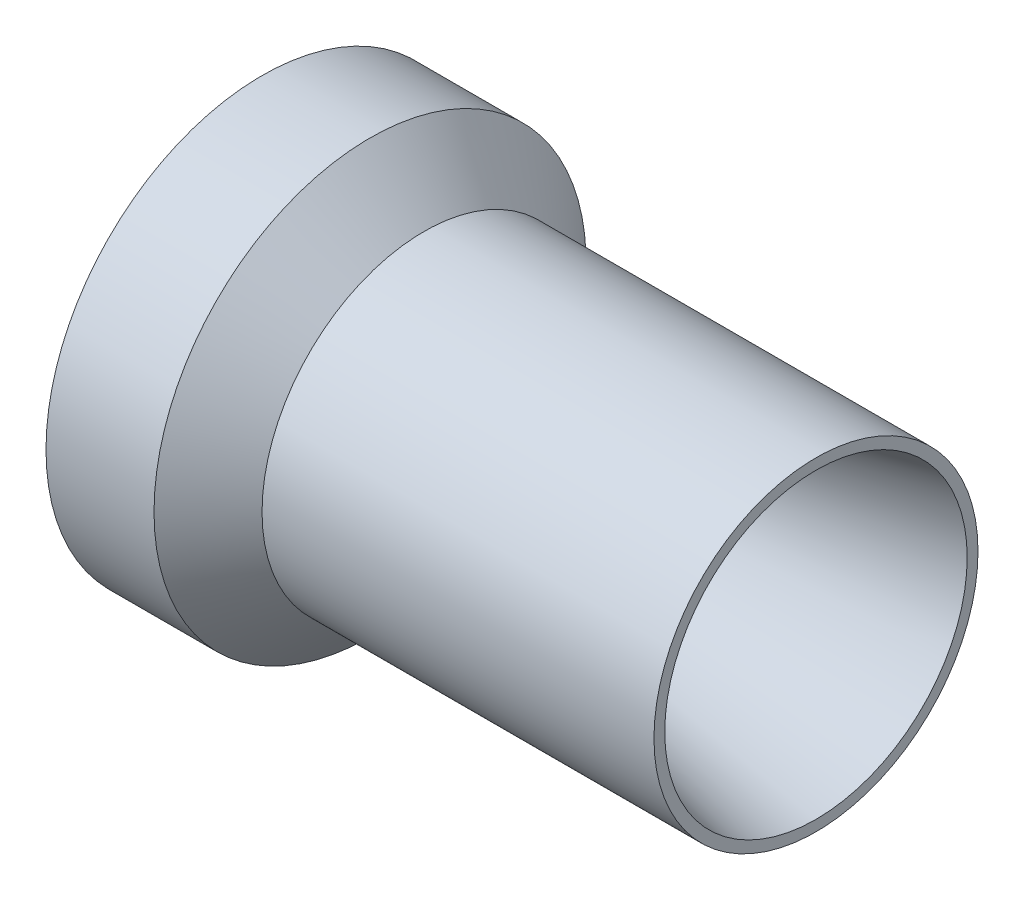
from build123d import *


with BuildPart() as part:
    # Sketch1 → Revolve1 (revolve)
    with BuildSketch(Plane.XY):
        Polygon((130.263203586, 22.225), (130.263203586, 24.765), (40.64, 43.815), (34.29, 43.815), (0, 9.525), (25.4, 9.525), (38.1, 22.225), align=None)
    revolve(axis=Axis((0, 60.325, 0), (1, 0, 0)))


solid = part.part
